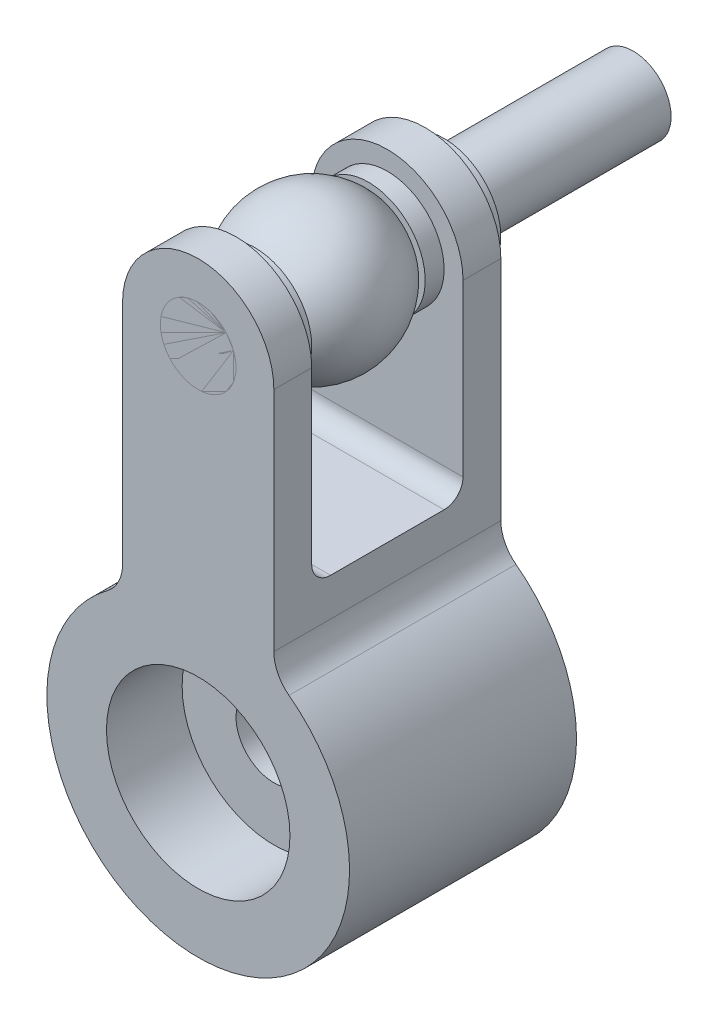
from build123d import *

# Parameters (mm, degrees)
SKETCH_1_R            = 1
EXTRUDE_1_DEPTH       = 3
SKETCH_1_R_2          = 2
EXTRUDE_1_2_DEPTH     = 3
EXTRUDE_START         = 2
SKETCH_2_R            = 1
EXTRUDE_2_DEPTH       = 1
SKETCH_3_R            = 1
EXTRUDE_3_DEPTH       = 1
EXTRUDE_4_REACH       = 9.874
EXTRUDE_4_END_RADIUS  = 2
SKETCH_4_W            = 4
SKETCH_4_H            = 6
SKETCH_6_R            = 4
EXTRUDE_5_DEPTH       = 6
SKETCH_7_R            = 2.425
CUT_EXTRUDE_2_DEPTH   = 2
SKETCH_8_R            = 1
CUT_EXTRUDE_3_DEPTH   = 14.266499161
FILLET_3_R            = 1
FILLET_2_R            = 0.5
SKETCH_9_R            = 1
EXTRUDE_6_DEPTH       = 3
SKETCH_11_R           = 1.5
SKETCH_11_R_2         = 1
EXTRUDE_7_DEPTH       = 0.5
SKETCH_12_R           = 1.5
SKETCH_12_R_2         = 1
EXTRUDE_8_DEPTH       = 0.5
MOVE_START            = -8.5
MOVE_FACE_1_OUTLINE_R = 1
MOVE_FACE_1_DEPTH     = 5.5


# Read off the part's stored shape, not the designer's step: 移动面1
with BuildPart() as part:
    # 草图1 → 凸台-拉伸1 (new, symmetric)
    with BuildSketch(Plane.XY):
        with Locations((0, 10)):
            Circle(SKETCH_1_R)
    extrude(amount=EXTRUDE_1_DEPTH, both=True)


with BuildPart() as body_2:
    # 草图1 → Extrude 1 2 (new, symmetric)
    with BuildSketch(Plane.XY):
        Circle(SKETCH_1_R_2)
        Circle(SKETCH_1_R, mode=Mode.SUBTRACT)
    extrude(amount=EXTRUDE_1_2_DEPTH, both=True)



with BuildPart() as body_3:
    # 草图2 → 凸台-拉伸2 (new body)
    with BuildSketch(Plane.XY.offset(EXTRUDE_START)):
        with BuildLine():
            Line((-2, 10), (-2, 5))
            Line((-2, 5), (2, 5))
            Line((2, 5), (2, 10))
            ThreePointArc((2, 10), (0, 12), (-2, 10))
        make_face()
        with Locations((0, 10)):
            Circle(SKETCH_2_R, mode=Mode.SUBTRACT)
    extrude(amount=EXTRUDE_2_DEPTH)



with BuildPart() as body_4:
    # 草图3 → 凸台-拉伸3 (new body)
    with BuildSketch(Plane(origin=(0, 0, -3), x_dir=(-1, 0, 0), z_dir=(0, 0, -1))):
        with BuildLine():
            Line((2, 5), (2, 10))
            ThreePointArc((2, 10), (0, 12), (-2, 10))
            Line((-2, 10), (-2, 5))
            Line((-2, 5), (2, 5))
        make_face()
        with Locations(Location((0, 10, 0), (0, 0, 180))):
            Circle(SKETCH_3_R, mode=Mode.SUBTRACT)
    extrude(amount=-EXTRUDE_3_DEPTH)


with BuildPart() as body_3_1:
    add(body_3.part)

    add(body_4.part)  # 凸台-拉伸4 merges body 4
    # 凸台-拉伸4: up to this cylinder (the profile starts outside it)
    extrude_4_end = Plane(origin=(0, 0, 0), z_dir=(0, 0, -1)) * Cylinder(EXTRUDE_4_END_RADIUS, 24.748, mode=Mode.PRIVATE)
    # 草图4 → 凸台-拉伸4 (add, up to the surface)
    with BuildSketch(Plane.XZ.offset(-5), mode=Mode.PRIVATE) as extrude_4_sk1:
        Rectangle(SKETCH_4_W, SKETCH_4_H)
    extrude_4_tool1 = extrude(extrude_4_sk1.sketch, amount=EXTRUDE_4_REACH, mode=Mode.PRIVATE) - extrude_4_end
    add(extrude_4_tool1.solids().sort_by_distance((0, 5, 0))[0])


with BuildPart() as body_4_2:
    # 草图5 → 旋转1 (revolve)
    with BuildSketch(Plane(origin=(0, 0, 0), x_dir=(0, 0, -1), z_dir=(1, 0, 0))):
        with BuildLine():
            Line((-0.5, 10), (0.5, 10))
            ThreePointArc((0.5, 10), (0, 10.5), (-0.5, 10))
        make_face()
    revolve(axis=Axis((0, 10, 2), (0, 0, -1)))


with BuildPart() as body_2_1:
    add(body_2.part)

    add(body_3_1.part)  # 凸台-拉伸5 merges body 3
    # 草图6 → 凸台-拉伸5 (add)
    with BuildSketch(Plane(origin=(0, 0, -3), x_dir=(-1, 0, 0), z_dir=(0, 0, -1))):
        Circle(SKETCH_6_R)
    extrude(amount=-EXTRUDE_5_DEPTH)

    # 草图7 → 切除-拉伸2 (cut)
    with BuildSketch(Plane(origin=(0, 0, 3), x_dir=(-1, 0, 0), z_dir=(0, 0, -1))):
        Circle(SKETCH_7_R)
    cut_extrude_2 = extrude(amount=CUT_EXTRUDE_2_DEPTH, mode=Mode.SUBTRACT)

    # 镜向1: 切除-拉伸2 across plane
    add(cut_extrude_2.mirror(Plane.XY), mode=Mode.SUBTRACT)

    # 草图8 → 切除-拉伸3 (cut, through all)
    with BuildSketch(Plane.XY.offset(1)):
        Circle(SKETCH_8_R)
    extrude(amount=-CUT_EXTRUDE_3_DEPTH, mode=Mode.SUBTRACT)

    # 圆角3
    fillet_3_edges = [body_2_1.edges().sort_by_distance(p)[0] for p in [
        (-2, 3.464101615, 0),
        (2, 3.464101615, 0),
    ]]
    fillet(fillet_3_edges, radius=FILLET_3_R)

    # 圆角2
    fillet_2_edges = [body_2_1.edges().sort_by_distance(p)[0] for p in [
        (0, 5, -2),
        (0, 5, 2),
    ]]
    fillet(fillet_2_edges, radius=FILLET_2_R)


with BuildPart() as body_4_3:
    # 草图9 → 凸台-拉伸6 (new, symmetric)
    with BuildSketch(Plane.XY):
        with Locations((0, 10)):
            Circle(SKETCH_9_R)
    extrude(amount=EXTRUDE_6_DEPTH, both=True)

    # Move Face 1 outline → Move Face 1 (add)
    with BuildSketch(Plane.XY.offset(MOVE_START)):
        with Locations((0, 10)):
            Circle(MOVE_FACE_1_OUTLINE_R)
    extrude(amount=MOVE_FACE_1_DEPTH)


with BuildPart() as body_5:
    # 草图10 → 旋转2 (revolve)
    with BuildSketch(Plane(origin=(0, 0, 0), x_dir=(0, 0, -1), z_dir=(1, 0, 0))):
        with BuildLine():
            ThreePointArc((1.5, 11.322875656), (0, 12), (-1.5, 11.322875656))
            Line((-1.5, 11.322875656), (-1.5, 11))
            Line((-1.5, 11), (1.5, 11))
            Line((1.5, 11), (1.5, 11.322875656))
        make_face()
    revolve(axis=Axis((0, 10, 3), (0, 0, -1)))


with BuildPart() as body_6:
    # 草图11 → 凸台-拉伸7 (new body)
    with BuildSketch(Plane.XY.offset(1.5)):
        with Locations((0, 10)):
            Circle(SKETCH_11_R)
        with Locations((0, 10)):
            Circle(SKETCH_11_R_2, mode=Mode.SUBTRACT)
    extrude(amount=EXTRUDE_7_DEPTH)


with BuildPart() as body_7:
    # 草图12 → 凸台-拉伸8 (new body)
    with BuildSketch(Plane(origin=(0, 0, -1.5), x_dir=(-1, 0, 0), z_dir=(0, 0, -1))):
        with Locations((0, 10)):
            Circle(SKETCH_12_R)
        with Locations((0, 10)):
            Circle(SKETCH_12_R_2, mode=Mode.SUBTRACT)
    extrude(amount=EXTRUDE_8_DEPTH)


with BuildPart() as body_8:
    # Move Body 1: copy of body 7
    add(body_7.part.moved(Location((0, 0, -1.5))))


solid = Compound([part.part, body_4_2.part, body_2_1.part, body_4_3.part, body_5.part, body_6.part, body_7.part, body_8.part])
